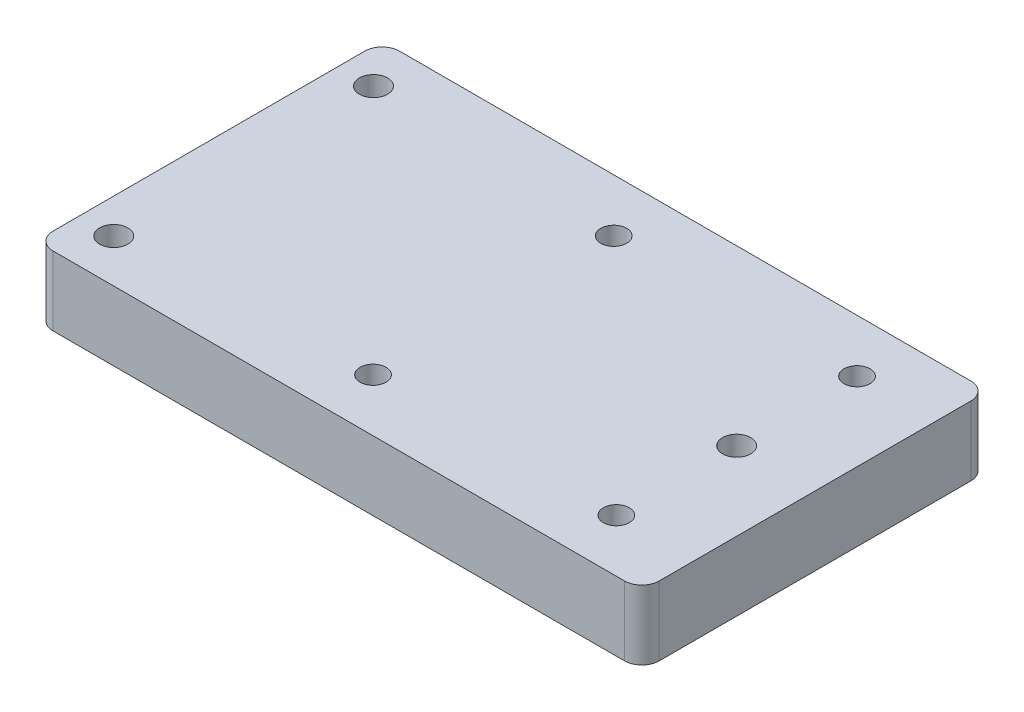
from build123d import *

# Parameters (mm, degrees)
SKETCH1_W             = 70
SKETCH1_H             = 40
BOSS_EXTRUDE1_DEPTH   = 8
F_3_0MM_DOWEL_HOLE1_D = 3
F_4_CLEARANCE_HOLE1_D = 3.2639
FILLET1_R             = 2


with BuildPart() as part:
    # Sketch1 → Boss-Extrude1 (new body)
    with BuildSketch(Plane(origin=(0, 0, 0), x_dir=(1, 0, 0), z_dir=(0, 1, 0))):
        Rectangle(SKETCH1_W, SKETCH1_H)
    extrude(amount=BOSS_EXTRUDE1_DEPTH)

    # Ø3.0mm Dowel Hole1 (through all)
    with Locations(Plane(origin=(0, 8, 0), x_dir=(1, 0, 0), z_dir=(0, 1, 0))):
        with Locations((-2.15, 13.9), (25.95, 13.9), (-2.15, -13.9), (25.95, -13.9)):
            Hole(F_3_0MM_DOWEL_HOLE1_D / 2)

    # #4 Clearance Hole1 (through all)
    with Locations(Plane(origin=(0, 8, 0), x_dir=(1, 0, 0), z_dir=(0, 1, 0))):
        with Locations((-31, 15), (-31, -15), (25.95, 0)):
            Hole(F_4_CLEARANCE_HOLE1_D / 2)

    # Fillet1
    fillet1_edges = [part.edges().sort_by_distance(p)[0] for p in [
        (-35, 4, -20),
        (-35, 4, 20),
        (35, 4, -20),
        (35, 4, 20),
    ]]
    fillet(fillet1_edges, radius=FILLET1_R)


solid = part.part
